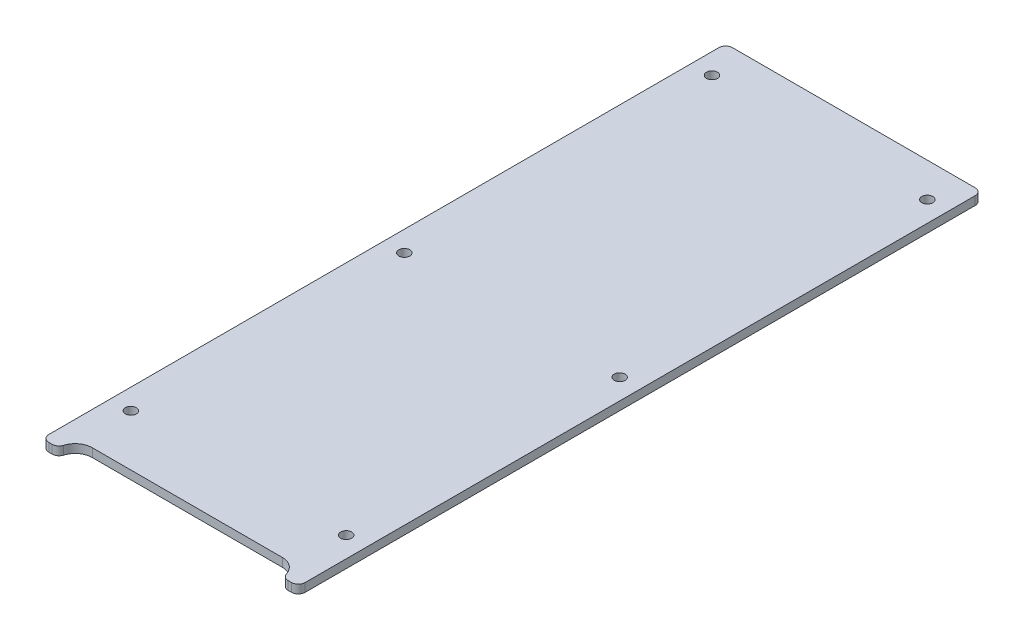
from build123d import *

# Parameters (mm, degrees)
SKETCH1_R           = 2.032
BOSS_EXTRUDE1_DEPTH = 3.175
FILLET1_R           = 2.54
FILLET2_R           = 2.54
FILLET3_R           = 6.35


with BuildPart() as part:
    # Sketch1 → Boss-Extrude1 (new body)
    with BuildSketch(Plane(origin=(0, 0, 0), x_dir=(1, 0, 0), z_dir=(0, 1, 0))):
        Polygon((47.625, 127), (-47.625, 127), (-47.625, -127), (-41.275, -127), (-41.275, -120.65), (41.275, -120.65), (41.275, -127), (47.625, -127), align=None)
        with Locations((-39.999684148, -101.6)):
            Circle(SKETCH1_R, mode=Mode.SUBTRACT)
        with Locations((39.999684148, -101.6)):
            Circle(SKETCH1_R, mode=Mode.SUBTRACT)
        with Locations((-39.999684148, 0)):
            Circle(SKETCH1_R, mode=Mode.SUBTRACT)
        with Locations((-39.999684148, 114.3)):
            Circle(SKETCH1_R, mode=Mode.SUBTRACT)
        with Locations((39.999684148, 0)):
            Circle(SKETCH1_R, mode=Mode.SUBTRACT)
        with Locations((39.999684148, 114.3)):
            Circle(SKETCH1_R, mode=Mode.SUBTRACT)
    extrude(amount=BOSS_EXTRUDE1_DEPTH)

    # Fillet1
    fillet1_edges = [part.edges().sort_by_distance(p)[0] for p in [
        (-47.625, 1.5875, -127),
        (47.625, 1.5875, -127),
        (47.625, 1.5875, 127),
        (-47.625, 1.5875, 127),
    ]]
    fillet(fillet1_edges, radius=FILLET1_R)

    # Fillet2
    fillet2_edges = [part.edges().sort_by_distance(p)[0] for p in [
        (41.275, 1.5875, 127),
        (-41.275, 1.5875, 127),
    ]]
    fillet(fillet2_edges, radius=FILLET2_R)

    # Fillet3
    fillet3_edges = [part.edges().sort_by_distance(p)[0] for p in [
        (41.275, 1.5875, 120.65),
        (-41.275, 1.5875, 120.65),
    ]]
    fillet(fillet3_edges, radius=FILLET3_R)


solid = part.part
